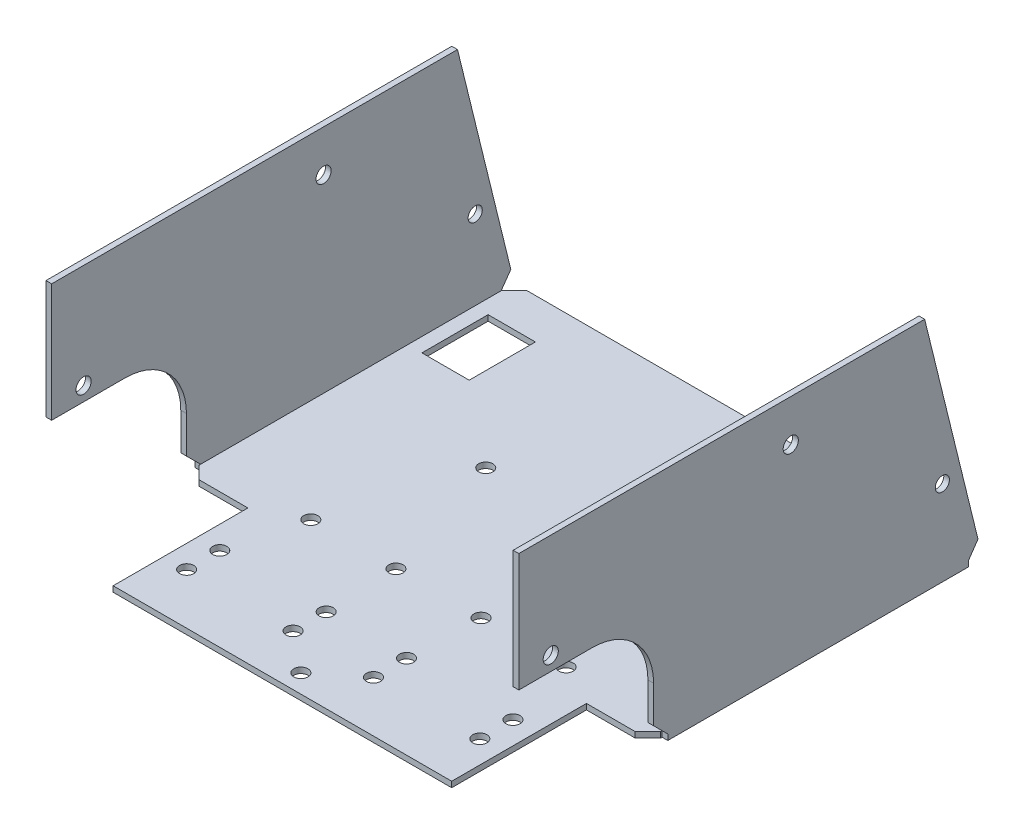
from build123d import *

# Parameters (mm, degrees)
SALIENTE_EXTRUIR1_DEPTH = 100
CROQUIS2_W              = 13
CROQUIS2_H              = 28.5
CORTAR_EXTRUIR2_DEPTH   = 10
CROQUIS3_R              = 1.5
CORTAR_EXTRUIR3_DEPTH   = 5
CROQUIS4_R              = 1.5
CORTAR_EXTRUIR4_DEPTH   = 10
CROQUIS5_R              = 1.5
CORTAR_EXTRUIR6_DEPTH   = 10
CORTAR_EXTRUIR8_DEPTH   = 151
CROQUIS7_W              = 1.2
CROQUIS7_H              = 2.5
CORTAR_EXTRUIR9_DEPTH   = 28.5
CROQUIS8_W              = 10
CROQUIS8_H              = 14
CORTAR_EXTRUIR10_DEPTH  = 10
CORTAR_EXTRUIR11_DEPTH  = 151
CROQUIS10_R             = 1.5
CORTAR_EXTRUIR12_DEPTH  = 149.746059648
CROQUIS11_R             = 1.6
CORTAR_EXTRUIR13_DEPTH  = 149.746059648
CORTAR_EXTRUIR14_DEPTH  = 121.444303563
CORTAR_EXTRUIR16_DEPTH  = 1.2
CORTAR_EXTRUIR17_DEPTH  = 1.2
CORTAR_EXTRUIR18_DEPTH  = 1.2
CORTAR_EXTRUIR19_DEPTH  = 1.2


with BuildPart() as part:
    # Croquis1 → Saliente-Extruir1 (new body)
    with BuildSketch(Plane.XY):
        Polygon((50, 0), (-50, 0), (-50, 50), (-48.8, 50), (-48.8, 1.2), (48.8, 1.2), (48.8, 50), (50, 50), align=None)
    extrude(amount=-SALIENTE_EXTRUIR1_DEPTH)

    # Croquis2 → Cortar-Extruir2 (cut)
    with BuildSketch(Plane(origin=(0, 1.2, 0), x_dir=(1, 0, 0), z_dir=(0, 1, 0))):
        with Locations((-42.3, 14.25)):
            Rectangle(CROQUIS2_W, CROQUIS2_H)
        with Locations((42.3, 14.25)):
            Rectangle(CROQUIS2_W, CROQUIS2_H)
    extrude(amount=-CORTAR_EXTRUIR2_DEPTH, mode=Mode.SUBTRACT)

    # Croquis3 → Cortar-Extruir3 (cut)
    with BuildSketch(Plane(origin=(0, 1.2, 0), x_dir=(1, 0, 0), z_dir=(0, 1, 0))):
        with Locations((0, 3.9)):
            Circle(CROQUIS3_R)
    extrude(amount=-CORTAR_EXTRUIR3_DEPTH, mode=Mode.SUBTRACT)

    # Croquis4 → Cortar-Extruir4 (cut)
    with BuildSketch(Plane(origin=(0, 1.2, 0), x_dir=(1, 0, 0), z_dir=(0, 1, 0))):
        with Locations((-8.5, 17.75)):
            Circle(CROQUIS4_R)
        with Locations((-8.5, 10.75)):
            Circle(CROQUIS4_R)
        with Locations((8.5, 10.75)):
            Circle(CROQUIS4_R)
        with Locations((8.5, 17.75)):
            Circle(CROQUIS4_R)
        with Locations((-31, 17.75)):
            Circle(CROQUIS4_R)
        with Locations((-31, 10.75)):
            Circle(CROQUIS4_R)
        with Locations((31, 10.75)):
            Circle(CROQUIS4_R)
        with Locations((31, 17.75)):
            Circle(CROQUIS4_R)
    extrude(amount=-CORTAR_EXTRUIR4_DEPTH, mode=Mode.SUBTRACT)

    # Croquis5 → Cortar-Extruir6 (cut)
    with BuildSketch(Plane(origin=(0, 1.2, 0), x_dir=(1, 0, 0), z_dir=(0, 1, 0))):
        with Locations((-18, 61)):
            Circle(CROQUIS5_R)
        with Locations((-27, 33)):
            Circle(CROQUIS5_R)
        with Locations((27, 33)):
            Circle(CROQUIS5_R)
        with Locations((18, 61)):
            Circle(CROQUIS5_R)
        with Locations((-9, 33)):
            Circle(CROQUIS5_R)
        with Locations((9, 33)):
            Circle(CROQUIS5_R)
    extrude(amount=-CORTAR_EXTRUIR6_DEPTH, mode=Mode.SUBTRACT)

    # Croquis6 → Cortar-Extruir8 (cut, through all)
    with BuildSketch(Plane.ZY.offset(50)):
        with BuildLine():
            Line((0, 25), (0, 2.5))
            Line((0, 2.5), (-28.5, 2.5))
            Line((-28.5, 2.5), (-28.5, 12))
            ThreePointArc((-28.5, 12), (-24.692388155, 21.192388155), (-15.5, 25))
            Line((-15.5, 25), (0, 25))
        make_face()
    extrude(amount=-CORTAR_EXTRUIR8_DEPTH, mode=Mode.SUBTRACT)

    # Croquis7 → Cortar-Extruir9 (cut)
    with BuildSketch(Plane.XY):
        with Locations((49.4, 1.25)):
            Rectangle(CROQUIS7_W, CROQUIS7_H)
        with Locations((-49.4, 1.25)):
            Rectangle(CROQUIS7_W, CROQUIS7_H)
    extrude(amount=-CORTAR_EXTRUIR9_DEPTH, mode=Mode.SUBTRACT)

    # Croquis8 → Cortar-Extruir10 (cut)
    with BuildSketch(Plane(origin=(0, 1.2, 0), x_dir=(1, 0, 0), z_dir=(0, 1, 0))):
        with Locations((-40.8, 82.301695329)):
            Rectangle(CROQUIS8_W, CROQUIS8_H)
        with Locations((40.8, 82.301695329)):
            Rectangle(CROQUIS8_W, CROQUIS8_H)
    extrude(amount=-CORTAR_EXTRUIR10_DEPTH, mode=Mode.SUBTRACT)

    # Croquis9 → Cortar-Extruir11 (cut, through all)
    with BuildSketch(Plane.ZY.offset(50)):
        Polygon((-100, -2.8), (-98.930483034, -3.344181459), (-85.827895361, 50), (-100, 50), align=None)
    extrude(amount=-CORTAR_EXTRUIR11_DEPTH, mode=Mode.SUBTRACT)

    # Croquis10 → Cortar-Extruir12 (cut, through all)
    with BuildSketch(Plane.ZY.offset(50)):
        with Locations((-89.568954366, 18)):
            Circle(CROQUIS10_R)
    extrude(amount=-CORTAR_EXTRUIR12_DEPTH, mode=Mode.SUBTRACT)

    # Croquis11 → Cortar-Extruir13 (cut, through all)
    with BuildSketch(Plane.ZY.offset(50)):
        with Locations((-57.509073284, 41.2)):
            Circle(CROQUIS11_R)
        with Locations((-6.747252001, 28)):
            Circle(CROQUIS11_R)
    extrude(amount=-CORTAR_EXTRUIR13_DEPTH, mode=Mode.SUBTRACT)

    # Croquis12 → Cortar-Extruir14 (cut, through all)
    with BuildSketch(Plane(origin=(0, 1.2, 0), x_dir=(1, 0, 0), z_dir=(0, 1, 0))):
        Polygon((-45.8, 98.109073284), (-48.8, 95.109073284), (-48.8, 98.109073284), align=None)
        Polygon((48.8, 95.109073284), (48.8, 98.109073284), (45.8, 98.109073284), align=None)
        Polygon((45.8, 28.20525173), (48.8, 31.20525173), (48.8, 28.20525173), align=None)
        Polygon((-45.8, 28.20525173), (-48.8, 31.20525173), (-48.8, 28.20525173), align=None)
    extrude(amount=-CORTAR_EXTRUIR14_DEPTH, mode=Mode.SUBTRACT)

    # Croquis13 → Cortar-Extruir16 (cut)
    with BuildSketch(Plane.ZY.offset(50)):
        Polygon((-98.109073284, 0), (-95.109073284, 0), (-95.109073284, 1.27), (-97.107232762, 4.078763976), align=None)
    extrude(amount=-CORTAR_EXTRUIR16_DEPTH, mode=Mode.SUBTRACT)

    # Croquis14 → Cortar-Extruir17 (cut)
    with BuildSketch(Plane(origin=(50, 0, 0), x_dir=(0, 0, -1), z_dir=(1, 0, 0))):
        Polygon((98.109073284, 0), (95.109073284, 0), (95.109073284, 1.2), (97.107232762, 4.078763976), align=None)
    extrude(amount=-CORTAR_EXTRUIR17_DEPTH, mode=Mode.SUBTRACT)

    # Croquis15 → Cortar-Extruir18 (cut)
    with BuildSketch(Plane(origin=(50, 0, 0), x_dir=(0, 0, -1), z_dir=(1, 0, 0))):
        Polygon((28.5, 0), (28.5, 4.2), (31.5, 1.2), (31.5, 0), align=None)
    extrude(amount=-CORTAR_EXTRUIR18_DEPTH, mode=Mode.SUBTRACT)

    # Croquis16 → Cortar-Extruir19 (cut)
    with BuildSketch(Plane.ZY.offset(50)):
        Polygon((-28.5, 0), (-28.5, 4.2), (-31.5, 1.2), (-31.5, 0), align=None)
    extrude(amount=-CORTAR_EXTRUIR19_DEPTH, mode=Mode.SUBTRACT)


solid = part.part
